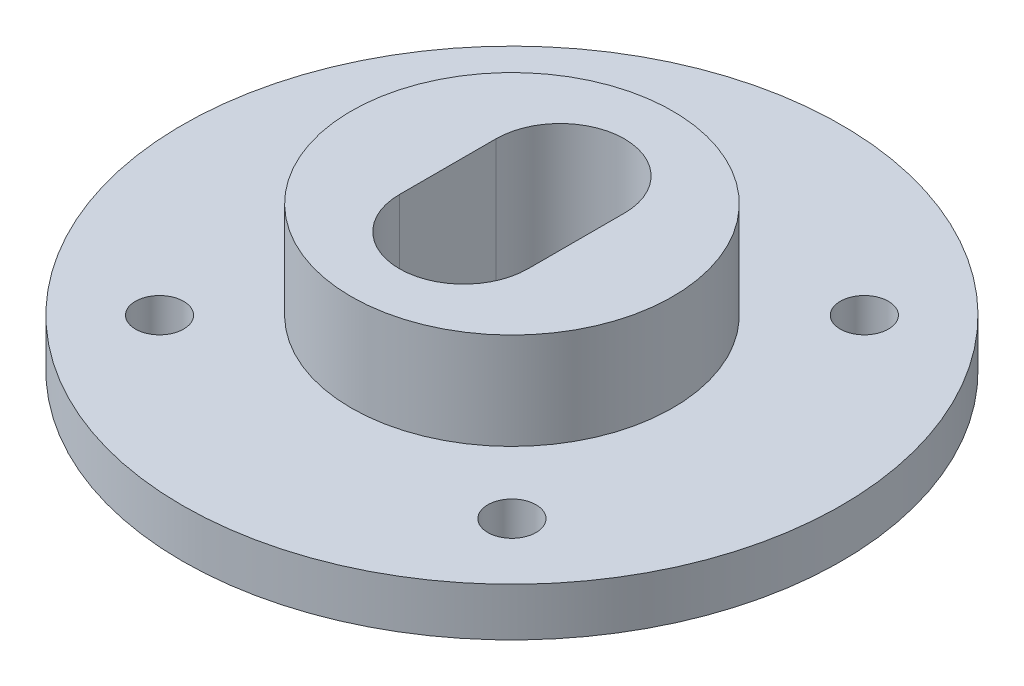
from build123d import *

# Parameters (mm, degrees)
SKETCH1_R           = 20.5
SKETCH1_R_2         = 1.5
BOSS_EXTRUDE1_DEPTH = 3
BOSS_EXTRUDE2_START = 6
SKETCH1_3_R         = 10
BOSS_EXTRUDE2_DEPTH = 6


with BuildPart() as part:
    # Sketch1 → Boss-Extrude1 (new body)
    with BuildSketch(Plane(origin=(0, 0, 0), x_dir=(1, 0, 0), z_dir=(0, 1, 0))):
        Circle(SKETCH1_R)
        with Locations((-10.960155108, -10.960155108)):
            Circle(SKETCH1_R_2, mode=Mode.SUBTRACT)
        with Locations((10.960155108, -10.960155108)):
            Circle(SKETCH1_R_2, mode=Mode.SUBTRACT)
        with Locations((-10.960155108, 10.960155108)):
            Circle(SKETCH1_R_2, mode=Mode.SUBTRACT)
        with Locations((10.960155108, 10.960155108)):
            Circle(SKETCH1_R_2, mode=Mode.SUBTRACT)
        with BuildLine():
            Line((4, 3), (4, -3))
            ThreePointArc((4, -3), (0, -7), (-4, -3))
            Line((-4, -3), (-4, 3))
            ThreePointArc((-4, 3), (0, 7), (4, 3))
        make_face(mode=Mode.SUBTRACT)
    extrude(amount=-BOSS_EXTRUDE1_DEPTH)

    # Sketch1<3> → Boss-Extrude2 (add)
    with BuildSketch(Plane(origin=(0, 0, 0), x_dir=(1, 0, 0), z_dir=(0, 1, 0)).offset(BOSS_EXTRUDE2_START)):
        Circle(SKETCH1_3_R)
        with BuildLine():
            Line((4, 3), (4, -3))
            ThreePointArc((4, -3), (0, -7), (-4, -3))
            Line((-4, -3), (-4, 3))
            ThreePointArc((-4, 3), (0, 7), (4, 3))
        make_face(mode=Mode.SUBTRACT)
    extrude(amount=-BOSS_EXTRUDE2_DEPTH)


solid = part.part
